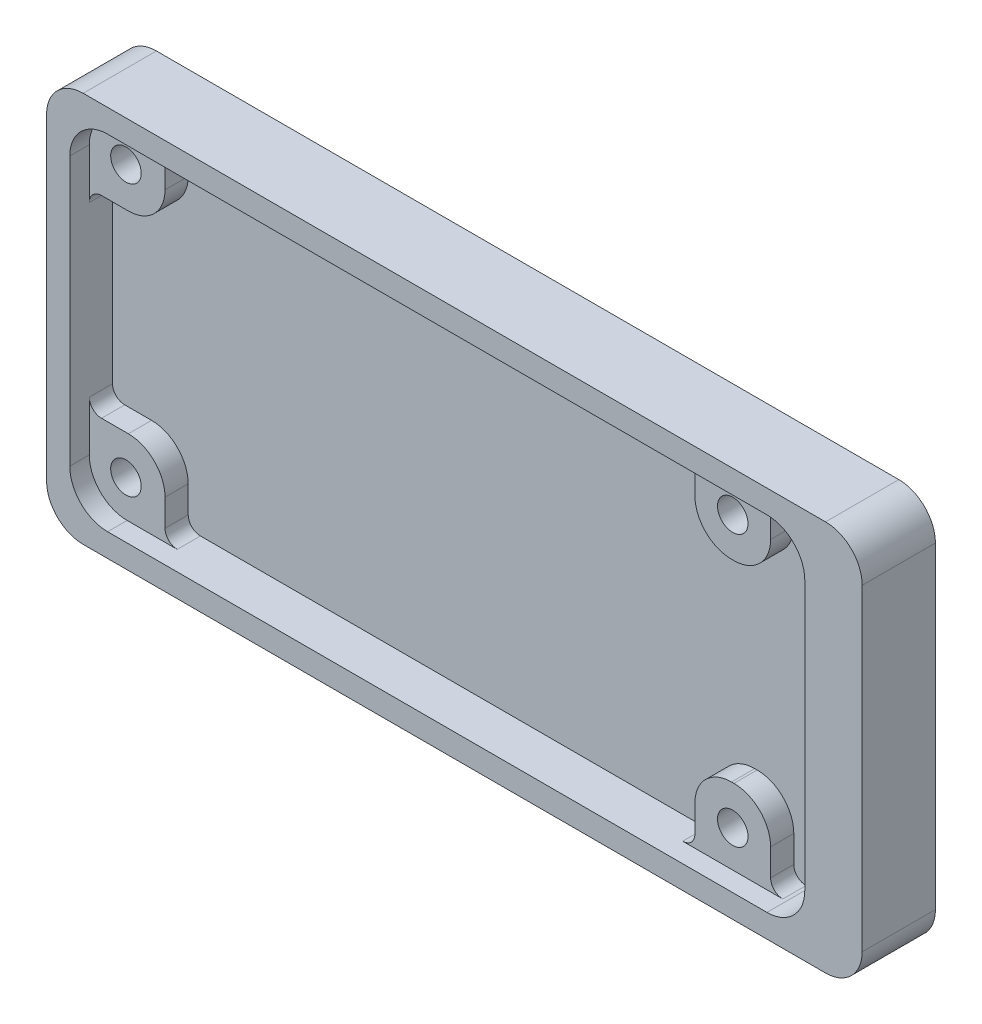
from build123d import *

# Parameters (mm, degrees)
EXTRUDE_1_DEPTH     = 6
CUT_EXTRUDE_1_DEPTH = 3.5
EXTRUDE_2_DEPTH     = 1.9
SKETCH_4_R          = 1.25
CUT_EXTRUDE_2_DEPTH = 75.311775648
SKETCH_11_R         = 2.4
CUT_EXTRUDE_3_DEPTH = 2.5
FILLET_1_R          = 1


with BuildPart() as part:
    # Эскиз1 → Бобышка-Вытянуть1 (new body)
    with BuildSketch(Plane.XY):
        with BuildLine():
            Line((3, 0), (63.8, 0))
            ThreePointArc((63.8, 0), (65.921320344, 0.878679656), (66.8, 3))
            Line((66.8, 3), (66.8, 29))
            ThreePointArc((66.8, 29), (65.921320344, 31.121320344), (63.8, 32))
            Line((63.8, 32), (3, 32))
            ThreePointArc((3, 32), (0.878679656, 31.121320344), (0, 29))
            Line((0, 29), (0, 3))
            ThreePointArc((0, 3), (0.878679656, 0.878679656), (3, 0))
        make_face()
    extrude(amount=EXTRUDE_1_DEPTH)

    # Эскиз2 → Вырез-Вытянуть1 (cut)
    with BuildSketch(Plane.XY.offset(6)):
        with BuildLine():
            Line((5, 30.1), (59, 30.1))
            ThreePointArc((59, 30.1), (61.192031022, 29.192031022), (62.1, 27))
            Line((62.1, 27), (62.1, 5))
            ThreePointArc((62.1, 5), (61.192031022, 2.807968978), (59, 1.9))
            Line((59, 1.9), (5, 1.9))
            ThreePointArc((5, 1.9), (2.807968978, 2.807968978), (1.9, 5))
            Line((1.9, 5), (1.9, 27))
            ThreePointArc((1.9, 27), (2.807968978, 29.192031022), (5, 30.1))
        make_face()
    extrude(amount=-CUT_EXTRUDE_1_DEPTH, mode=Mode.SUBTRACT)

    # Эскиз3 → Бобышка-Вытянуть2 (add)
    with BuildSketch(Plane.XY.offset(2.5)):
        with BuildLine():
            Line((4.9, 30.1), (8.1, 30.1))
            Line((8.1, 30.1), (8.1, 26.9))
            ThreePointArc((8.1, 26.9), (7.221320344, 24.778679656), (5.1, 23.9))
            Line((5.1, 23.9), (1.9, 23.9))
            Line((1.9, 23.9), (1.9, 27.1))
            ThreePointArc((1.9, 27.1), (2.778679656, 29.221320344), (4.9, 30.1))
        make_face()
        with BuildLine():
            Line((1.9, 8.1), (5.1, 8.1))
            ThreePointArc((5.1, 8.1), (7.221320344, 7.221320344), (8.1, 5.1))
            Line((8.1, 5.1), (8.1, 1.9))
            Line((8.1, 1.9), (4.9, 1.9))
            ThreePointArc((4.9, 1.9), (2.778679656, 2.778679656), (1.9, 4.9))
            Line((1.9, 4.9), (1.9, 8.1))
        make_face()
        with BuildLine():
            Line((51.5, 30.1), (57.7, 30.1))
            Line((57.7, 30.1), (57.7, 26.9))
            ThreePointArc((57.7, 26.9), (56.821320344, 24.778679656), (54.7, 23.9))
            Line((54.7, 23.9), (54.5, 23.9))
            ThreePointArc((54.5, 23.9), (52.378679656, 24.778679656), (51.5, 26.9))
            Line((51.5, 26.9), (51.5, 30.1))
        make_face()
        with BuildLine():
            Line((51.5, 1.9), (57.7, 1.9))
            Line((57.7, 1.9), (57.7, 5.1))
            ThreePointArc((57.7, 5.1), (56.821320344, 7.221320344), (54.7, 8.1))
            Line((54.7, 8.1), (54.5, 8.1))
            ThreePointArc((54.5, 8.1), (52.378679656, 7.221320344), (51.5, 5.1))
            Line((51.5, 5.1), (51.5, 1.9))
        make_face()
    extrude(amount=EXTRUDE_2_DEPTH)

    # Эскиз4 → Вырез-Вытянуть2 (cut, through all)
    with BuildSketch(Plane(origin=(0, 0, 0), x_dir=(-1, 0, 0), z_dir=(0, 0, -1))):
        with Locations((-54.6, 27.1)):
            Circle(SKETCH_4_R)
        with Locations((-4.9, 27.1)):
            Circle(SKETCH_4_R)
        with Locations((-4.9, 4.9)):
            Circle(SKETCH_4_R)
        with Locations((-54.6, 4.9)):
            Circle(SKETCH_4_R)
    extrude(amount=-CUT_EXTRUDE_2_DEPTH, mode=Mode.SUBTRACT)

    # Эскиз11 → Вырез-Вытянуть3 (cut)
    with BuildSketch(Plane(origin=(0, 0, 0), x_dir=(-1, 0, 0), z_dir=(0, 0, -1))):
        with Locations((-54.6, 27.1)):
            Circle(SKETCH_11_R)
        with Locations((-4.9, 27.1)):
            Circle(SKETCH_11_R)
        with Locations((-54.6, 4.9)):
            Circle(SKETCH_11_R)
        with Locations((-4.9, 4.9)):
            Circle(SKETCH_11_R)
    extrude(amount=-CUT_EXTRUDE_3_DEPTH, mode=Mode.SUBTRACT)

    # Скругление1
    fillet_1_edges = [part.edges().sort_by_distance(p)[0] for p in [
        (51.5, 1.9, 3.45),
        (57.7, 1.9, 3.45),
        (1.9, 8.1, 3.45),
        (8.1, 1.9, 3.45),
        (1.9, 23.9, 3.45),
        (8.1, 30.1, 3.45),
        (57.7, 30.1, 3.45),
        (51.5, 30.1, 3.45),
    ]]
    fillet(fillet_1_edges, radius=FILLET_1_R)


solid = part.part
